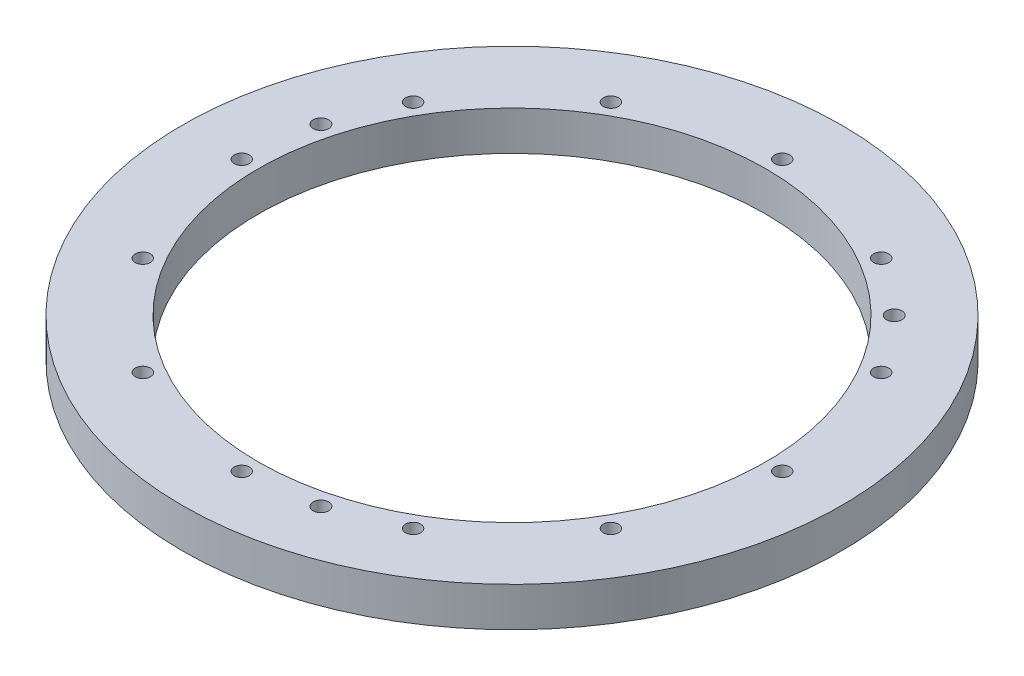
from build123d import *

# Parameters (mm, degrees)
SKETCH1_R           = 63.881
SKETCH1_R_2         = 1.4732
SKETCH1_R_3         = 49.2125
BOSS_EXTRUDE1_DEPTH = 7.62
SKETCH2_R           = 1.500000048
CUT_EXTRUDE1_DEPTH  = 91.662168086
CIRPATTERN1_COUNT   = 3


with BuildPart() as part:
    # Sketch1 → Boss-Extrude1 (new body)
    with BuildSketch(Plane(origin=(0, 0, 0), x_dir=(1, 0, 0), z_dir=(0, 1, 0))):
        Circle(SKETCH1_R)
        with Locations((0, -52.3875)):
            Circle(SKETCH1_R_2, mode=Mode.SUBTRACT)
        with Locations((-26.19375, -45.368905841)):
            Circle(SKETCH1_R_2, mode=Mode.SUBTRACT)
        with Locations((-45.368905841, -26.19375)):
            Circle(SKETCH1_R_2, mode=Mode.SUBTRACT)
        Circle(SKETCH1_R_3, mode=Mode.SUBTRACT)
        with Locations((26.19375, -45.368905841)):
            Circle(SKETCH1_R_2, mode=Mode.SUBTRACT)
        with Locations((45.368905841, -26.19375)):
            Circle(SKETCH1_R_2, mode=Mode.SUBTRACT)
        with Locations((52.3875, 0)):
            Circle(SKETCH1_R_2, mode=Mode.SUBTRACT)
        with Locations((-52.3875, 0)):
            Circle(SKETCH1_R_2, mode=Mode.SUBTRACT)
        with Locations((-45.368905841, 26.19375)):
            Circle(SKETCH1_R_2, mode=Mode.SUBTRACT)
        with Locations((-26.19375, 45.368905841)):
            Circle(SKETCH1_R_2, mode=Mode.SUBTRACT)
        with Locations((45.368905841, 26.19375)):
            Circle(SKETCH1_R_2, mode=Mode.SUBTRACT)
        with Locations((26.19375, 45.368905841)):
            Circle(SKETCH1_R_2, mode=Mode.SUBTRACT)
        with Locations((0, 52.3875)):
            Circle(SKETCH1_R_2, mode=Mode.SUBTRACT)
    extrude(amount=BOSS_EXTRUDE1_DEPTH)

    # Sketch2 → Cut-Extrude1 (cut, through all)
    with BuildSketch(Plane(origin=(0, 7.62, 0), x_dir=(1, 0, 0), z_dir=(0, 1, 0))):
        with Locations((-50.602439225, 13.558882725)):
            Circle(SKETCH2_R)
    cut_extrude1 = extrude(amount=-CUT_EXTRUDE1_DEPTH, mode=Mode.SUBTRACT)

    # CirPattern1: Cut-Extrude1 ×3 about axis
    cirpattern1_axis = Axis((0, 7.62, 0), (0, 1, 0))
    for i in range(1, CIRPATTERN1_COUNT):
        add(cut_extrude1.rotate(cirpattern1_axis, i * 360 / CIRPATTERN1_COUNT), mode=Mode.SUBTRACT)


solid = part.part
